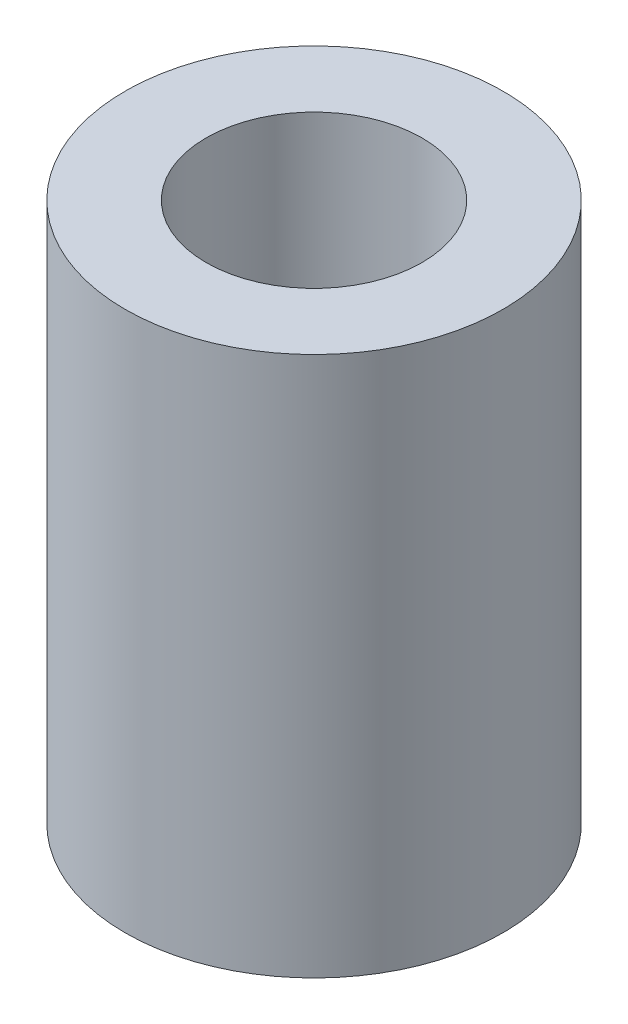
from build123d import *

# Parameters (mm, degrees)
SKETCH1_R           = 11.1125
SKETCH1_R_2         = 6.35
BOSS_EXTRUDE1_DEPTH = 31.75


with BuildPart() as part:
    # Sketch1 → Boss-Extrude1 (new body)
    with BuildSketch(Plane(origin=(0, 0, 0), x_dir=(1, 0, 0), z_dir=(0, 1, 0))):
        Circle(SKETCH1_R)
        Circle(SKETCH1_R_2, mode=Mode.SUBTRACT)
    extrude(amount=BOSS_EXTRUDE1_DEPTH)


solid = part.part
